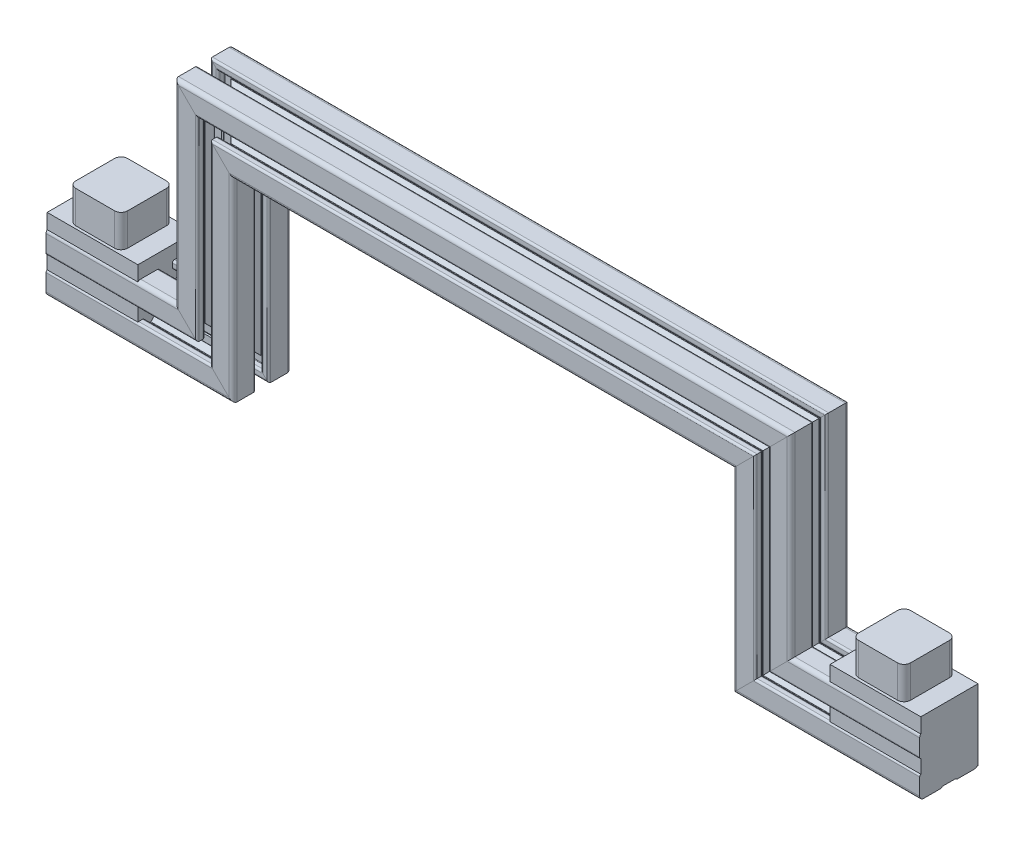
from build123d import *

# Parameters (mm, degrees)
SKETCH6_W            = 44.121320344
SKETCH6_H            = 54.791290411
BOSS_EXTRUDE3_DEPTH  = 70
SKETCH4_W            = 40
SKETCH4_H            = 40
RL_WHEEL_MOUNT_DEPTH = 25
FILLET1_R            = 5
FILLET1_OF_MIRROR1_R = 5


with BuildPart() as part:
    # Sweep1: sweep along a path in Sketch1
    with BuildLine(Plane.XY) as sweep1_path:
        Line((0, 0), (125, 0))
        Line((125, 0), (125, 150))
        Line((125, 150), (337, 150))
    # Sketch7 → Sweep1 (sweep)
    with BuildSketch(Plane(origin=(0, 0, 0), x_dir=(0, 0, -1), z_dir=(1, 0, 0))):
        with BuildLine():
            Line((4.905816029, 11.21531926), (4.005816103, 10.700171216))
            Line((4.005816103, 10.700171216), (3.105816176, 11.21531926))
            Line((3.105816176, 11.21531926), (-2.197508215, 11.21531926))
            ThreePointArc((-2.197508215, 11.21531926), (-2.342927919, 11.244245037), (-2.466208792, 11.326618683))
            Line((-2.466208792, 11.326618683), (-5.932884474, 14.793294365))
            ThreePointArc((-5.932884474, 14.793294365), (-6.01525812, 14.916575238), (-6.044183897, 15.061994942))
            Line((-6.044183897, 15.061994942), (-6.044183897, 19.35531926))
            ThreePointArc((-6.044183897, 19.35531926), (-5.932884474, 19.624019836), (-5.664183897, 19.73531926))
            Line((-5.664183897, 19.73531926), (-2.579183897, 19.73531926))
            ThreePointArc((-2.579183897, 19.73531926), (-1.50438159, 20.180516952), (-1.059183897, 21.25531926))
            Line((-1.059183897, 21.25531926), (-1.059183897, 24.21531926))
            ThreePointArc((-1.059183897, 24.21531926), (-1.50438159, 25.290121567), (-2.579183897, 25.73531926))
            Line((-2.579183897, 25.73531926), (-15.494183897, 25.73531926))
            ThreePointArc((-15.494183897, 25.73531926), (-17.615504241, 24.856639603), (-18.494183897, 22.73531926))
            Line((-18.494183897, 22.73531926), (-18.494183897, 9.82031926))
            ThreePointArc((-18.494183897, 9.82031926), (-18.048986205, 8.745516952), (-16.974183897, 8.30031926))
            Line((-16.974183897, 8.30031926), (-14.014183897, 8.30031926))
            ThreePointArc((-14.014183897, 8.30031926), (-12.93938159, 8.745516952), (-12.494183897, 9.82031926))
            Line((-12.494183897, 9.82031926), (-12.494183897, 12.90531926))
            ThreePointArc((-12.494183897, 12.90531926), (-12.382884474, 13.174019836), (-12.114183897, 13.28531926))
            Line((-12.114183897, 13.28531926), (-7.813788512, 13.28531926))
            ThreePointArc((-7.813788512, 13.28531926), (-7.668368808, 13.256393482), (-7.545087935, 13.174019836))
            Line((-7.545087935, 13.174019836), (-4.08548332, 9.714415222))
            ThreePointArc((-4.08548332, 9.714415222), (-4.003109675, 9.591134349), (-3.974183897, 9.445714645))
            Line((-3.974183897, 9.445714645), (-3.974183897, 4.135318895))
            Line((-3.974183897, 4.135318895), (-3.454570628, 3.23531926))
            Line((-3.454570628, 3.23531926), (-3.974183897, 2.335319624))
            Line((-3.974183897, 2.335319624), (-3.974183897, -2.968005058))
            ThreePointArc((-3.974183897, -2.968005058), (-4.003109675, -3.113424762), (-4.08548332, -3.236705635))
            Line((-4.08548332, -3.236705635), (-7.552159003, -6.703381317))
            ThreePointArc((-7.552159003, -6.703381317), (-7.675439876, -6.785754963), (-7.82085958, -6.81468074))
            Line((-7.82085958, -6.81468074), (-12.114183897, -6.81468074))
            ThreePointArc((-12.114183897, -6.81468074), (-12.382884474, -6.703381317), (-12.494183897, -6.43468074))
            Line((-12.494183897, -6.43468074), (-12.494183897, -3.34968074))
            ThreePointArc((-12.494183897, -3.34968074), (-12.93938159, -2.274878433), (-14.014183897, -1.82968074))
            Line((-14.014183897, -1.82968074), (-16.974183897, -1.82968074))
            ThreePointArc((-16.974183897, -1.82968074), (-18.048986205, -2.274878433), (-18.494183897, -3.34968074))
            Line((-18.494183897, -3.34968074), (-18.494183897, -16.26468074))
            ThreePointArc((-18.494183897, -16.26468074), (-17.615504241, -18.386001084), (-15.494183897, -19.26468074))
            Line((-15.494183897, -19.26468074), (-2.579183897, -19.26468074))
            ThreePointArc((-2.579183897, -19.26468074), (-1.50438159, -18.819483048), (-1.059183897, -17.74468074))
            Line((-1.059183897, -17.74468074), (-1.059183897, -14.78468074))
            ThreePointArc((-1.059183897, -14.78468074), (-1.50438159, -13.709878433), (-2.579183897, -13.26468074))
            Line((-2.579183897, -13.26468074), (-5.664183897, -13.26468074))
            ThreePointArc((-5.664183897, -13.26468074), (-5.932884474, -13.153381317), (-6.044183897, -12.88468074))
            Line((-6.044183897, -12.88468074), (-6.044183897, -8.584285355))
            ThreePointArc((-6.044183897, -8.584285355), (-6.01525812, -8.438865651), (-5.932884474, -8.315584778))
            Line((-5.932884474, -8.315584778), (-2.473279859, -4.855980164))
            ThreePointArc((-2.473279859, -4.855980164), (-2.349998987, -4.773606518), (-2.204579283, -4.74468074))
            Line((-2.204579283, -4.74468074), (3.105816176, -4.74468074))
            Line((3.105816176, -4.74468074), (4.005816103, -4.229532697))
            Line((4.005816103, -4.229532697), (4.905816029, -4.74468074))
            Line((4.905816029, -4.74468074), (10.20914042, -4.74468074))
            ThreePointArc((10.20914042, -4.74468074), (10.354560124, -4.773606518), (10.477840997, -4.855980164))
            Line((10.477840997, -4.855980164), (13.94451668, -8.322655846))
            ThreePointArc((13.94451668, -8.322655846), (14.026890325, -8.445936719), (14.055816103, -8.591356423))
            Line((14.055816103, -8.591356423), (14.055816103, -12.88468074))
            ThreePointArc((14.055816103, -12.88468074), (13.94451668, -13.153381317), (13.675816103, -13.26468074))
            Line((13.675816103, -13.26468074), (10.590816103, -13.26468074))
            ThreePointArc((10.590816103, -13.26468074), (9.516013795, -13.709878433), (9.070816103, -14.78468074))
            Line((9.070816103, -14.78468074), (9.070816103, -17.74468074))
            ThreePointArc((9.070816103, -17.74468074), (9.516013795, -18.819483048), (10.590816103, -19.26468074))
            Line((10.590816103, -19.26468074), (23.505816103, -19.26468074))
            ThreePointArc((23.505816103, -19.26468074), (25.627136446, -18.386001084), (26.505816103, -16.26468074))
            Line((26.505816103, -16.26468074), (26.505816103, -3.34968074))
            ThreePointArc((26.505816103, -3.34968074), (26.06061841, -2.274878433), (24.985816103, -1.82968074))
            Line((24.985816103, -1.82968074), (22.025816103, -1.82968074))
            ThreePointArc((22.025816103, -1.82968074), (20.951013795, -2.274878433), (20.505816103, -3.34968074))
            Line((20.505816103, -3.34968074), (20.505816103, -6.43468074))
            ThreePointArc((20.505816103, -6.43468074), (20.39451668, -6.703381317), (20.125816103, -6.81468074))
            Line((20.125816103, -6.81468074), (15.825420717, -6.81468074))
            ThreePointArc((15.825420717, -6.81468074), (15.680001013, -6.785754963), (15.556720141, -6.703381317))
            Line((15.556720141, -6.703381317), (12.097115526, -3.243776702))
            ThreePointArc((12.097115526, -3.243776702), (12.01474188, -3.12049583), (11.985816103, -2.975076126))
            Line((11.985816103, -2.975076126), (11.985816103, 2.335319624))
            Line((11.985816103, 2.335319624), (11.466202833, 3.23531926))
            Line((11.466202833, 3.23531926), (11.985816103, 4.135318895))
            Line((11.985816103, 4.135318895), (11.985816103, 9.438643577))
            ThreePointArc((11.985816103, 9.438643577), (12.01474188, 9.584063281), (12.097115526, 9.707344154))
            Line((12.097115526, 9.707344154), (15.563791208, 13.174019836))
            ThreePointArc((15.563791208, 13.174019836), (15.687072081, 13.256393482), (15.832491785, 13.28531926))
            Line((15.832491785, 13.28531926), (20.125816103, 13.28531926))
            ThreePointArc((20.125816103, 13.28531926), (20.39451668, 13.174019836), (20.505816103, 12.90531926))
            Line((20.505816103, 12.90531926), (20.505816103, 9.82031926))
            ThreePointArc((20.505816103, 9.82031926), (20.951013795, 8.745516952), (22.025816103, 8.30031926))
            Line((22.025816103, 8.30031926), (24.985816103, 8.30031926))
            ThreePointArc((24.985816103, 8.30031926), (26.06061841, 8.745516952), (26.505816103, 9.82031926))
            Line((26.505816103, 9.82031926), (26.505816103, 22.73531926))
            ThreePointArc((26.505816103, 22.73531926), (25.627136446, 24.856639603), (23.505816103, 25.73531926))
            Line((23.505816103, 25.73531926), (10.590816103, 25.73531926))
            ThreePointArc((10.590816103, 25.73531926), (9.516013795, 25.290121567), (9.070816103, 24.21531926))
            Line((9.070816103, 24.21531926), (9.070816103, 21.25531926))
            ThreePointArc((9.070816103, 21.25531926), (9.516013795, 20.180516952), (10.590816103, 19.73531926))
            Line((10.590816103, 19.73531926), (13.675816103, 19.73531926))
            ThreePointArc((13.675816103, 19.73531926), (13.94451668, 19.624019836), (14.055816103, 19.35531926))
            Line((14.055816103, 19.35531926), (14.055816103, 15.054923874))
            ThreePointArc((14.055816103, 15.054923874), (14.026890325, 14.90950417), (13.94451668, 14.786223298))
            Line((13.94451668, 14.786223298), (10.484912065, 11.326618683))
            ThreePointArc((10.484912065, 11.326618683), (10.361631192, 11.244245037), (10.216211488, 11.21531926))
            Line((10.216211488, 11.21531926), (4.905816029, 11.21531926))
        make_face()
        with BuildLine():
            Line((13.969837884, 21.274341041), (13.529837884, 21.274341041))
            ThreePointArc((13.529837884, 21.274341041), (12.469177713, 21.713680869), (12.029837884, 22.774341041))
            Line((12.029837884, 22.774341041), (12.029837884, 23.274341041))
            ThreePointArc((12.029837884, 23.274341041), (12.469177713, 24.335001213), (13.529837884, 24.774341041))
            Line((13.529837884, 24.774341041), (23.139837884, 24.774341041))
            ThreePointArc((23.139837884, 24.774341041), (24.752041345, 24.106544502), (25.419837884, 22.494341041))
            Line((25.419837884, 22.494341041), (25.419837884, 12.884341041))
            ThreePointArc((25.419837884, 12.884341041), (24.980498056, 11.823680869), (23.919837884, 11.384341041))
            Line((23.919837884, 11.384341041), (23.419837884, 11.384341041))
            ThreePointArc((23.419837884, 11.384341041), (22.359177713, 11.823680869), (21.919837884, 12.884341041))
            Line((21.919837884, 12.884341041), (21.919837884, 13.324341041))
            ThreePointArc((21.919837884, 13.324341041), (21.626944666, 14.031447822), (20.919837884, 14.324341041))
            Line((20.919837884, 14.324341041), (15.349837884, 14.324341041))
            ThreePointArc((15.349837884, 14.324341041), (15.081137307, 14.435640464), (14.969837884, 14.704341041))
            Line((14.969837884, 14.704341041), (14.969837884, 20.274341041))
            ThreePointArc((14.969837884, 20.274341041), (14.676944666, 20.981447822), (13.969837884, 21.274341041))
        make_face(mode=Mode.SUBTRACT)
        with BuildLine():
            Line((21.958859666, -6.68968074), (21.958859666, -6.24968074))
            ThreePointArc((21.958859666, -6.24968074), (22.398199494, -5.189020569), (23.458859666, -4.74968074))
            Line((23.458859666, -4.74968074), (23.958859666, -4.74968074))
            ThreePointArc((23.958859666, -4.74968074), (25.019519838, -5.189020569), (25.458859666, -6.24968074))
            Line((25.458859666, -6.24968074), (25.458859666, -15.85968074))
            ThreePointArc((25.458859666, -15.85968074), (24.791063127, -17.471884201), (23.178859666, -18.13968074))
            Line((23.178859666, -18.13968074), (13.568859666, -18.13968074))
            ThreePointArc((13.568859666, -18.13968074), (12.508199494, -17.700340912), (12.068859666, -16.63968074))
            Line((12.068859666, -16.63968074), (12.068859666, -16.13968074))
            ThreePointArc((12.068859666, -16.13968074), (12.508199494, -15.079020569), (13.568859666, -14.63968074))
            Line((13.568859666, -14.63968074), (14.008859666, -14.63968074))
            ThreePointArc((14.008859666, -14.63968074), (14.715966447, -14.346787522), (15.008859666, -13.63968074))
            Line((15.008859666, -13.63968074), (15.008859666, -8.06968074))
            ThreePointArc((15.008859666, -8.06968074), (15.120159089, -7.800980164), (15.388859666, -7.68968074))
            Line((15.388859666, -7.68968074), (20.958859666, -7.68968074))
            ThreePointArc((20.958859666, -7.68968074), (21.665966447, -7.396787522), (21.958859666, -6.68968074))
        make_face(mode=Mode.SUBTRACT)
        with BuildLine():
            Line((-6.005162116, -14.678702522), (-5.565162116, -14.678702522))
            ThreePointArc((-5.565162116, -14.678702522), (-4.504501944, -15.11804235), (-4.065162116, -16.178702522))
            Line((-4.065162116, -16.178702522), (-4.065162116, -16.678702522))
            ThreePointArc((-4.065162116, -16.678702522), (-4.504501944, -17.739362694), (-5.565162116, -18.178702522))
            Line((-5.565162116, -18.178702522), (-15.175162116, -18.178702522))
            ThreePointArc((-15.175162116, -18.178702522), (-16.787365577, -17.510905983), (-17.455162116, -15.898702522))
            Line((-17.455162116, -15.898702522), (-17.455162116, -6.288702522))
            ThreePointArc((-17.455162116, -6.288702522), (-17.015822287, -5.22804235), (-15.955162116, -4.788702522))
            Line((-15.955162116, -4.788702522), (-15.455162116, -4.788702522))
            ThreePointArc((-15.455162116, -4.788702522), (-14.394501944, -5.22804235), (-13.955162116, -6.288702522))
            Line((-13.955162116, -6.288702522), (-13.955162116, -6.728702522))
            ThreePointArc((-13.955162116, -6.728702522), (-13.662268897, -7.435809303), (-12.955162116, -7.728702522))
            Line((-12.955162116, -7.728702522), (-7.385162116, -7.728702522))
            ThreePointArc((-7.385162116, -7.728702522), (-7.116461539, -7.840001945), (-7.005162116, -8.108702522))
            Line((-7.005162116, -8.108702522), (-7.005162116, -13.678702522))
            ThreePointArc((-7.005162116, -13.678702522), (-6.712268897, -14.385809303), (-6.005162116, -14.678702522))
        make_face(mode=Mode.SUBTRACT)
        with BuildLine():
            Line((1.828915922, -2.488564034), (1.413170132, -2.316356489))
            ThreePointArc((1.413170132, -2.316356489), (0.823336155, -1.625307126), (1.036269925, -0.742067321))
            ThreePointArc((1.036269925, -0.742067321), (0.446703204, -0.237613869), (-0.057716637, 0.351981608))
            ThreePointArc((-0.057716637, 0.351981608), (-0.940937171, 0.139101897), (-1.631952253, 0.728927667))
            Line((-1.631952253, 0.728927667), (-1.804159798, 1.144673456))
            ThreePointArc((-1.804159798, 1.144673456), (-1.732589712, 2.050394753), (-0.957477943, 2.524372695))
            ThreePointArc((-0.957477943, 2.524372695), (-1.017662114, 3.297961778), (-0.957433843, 4.071547428))
            ThreePointArc((-0.957433843, 4.071547428), (-1.73249376, 4.54554997), (-1.804045409, 5.451241222))
            Line((-1.804045409, 5.451241222), (-1.631837865, 5.866987012))
            ThreePointArc((-1.631837865, 5.866987012), (-0.940788501, 6.456820989), (-0.057548696, 6.243887219))
            ThreePointArc((-0.057548696, 6.243887219), (0.446904755, 6.83345394), (1.036500233, 7.33787378))
            ThreePointArc((1.036500233, 7.33787378), (0.823620522, 8.221094315), (1.413446291, 8.912109397))
            Line((1.413446291, 8.912109397), (1.829192081, 9.084316942))
            ThreePointArc((1.829192081, 9.084316942), (2.734913377, 9.012746856), (3.20889132, 8.237635087))
            ThreePointArc((3.20889132, 8.237635087), (3.982480402, 8.297819258), (4.756066053, 8.237590987))
            ThreePointArc((4.756066053, 8.237590987), (5.230068594, 9.012650904), (6.135759847, 9.084202553))
            Line((6.135759847, 9.084202553), (6.551505636, 8.911995008))
            ThreePointArc((6.551505636, 8.911995008), (7.141339614, 8.220945645), (6.928405843, 7.33770584))
            ThreePointArc((6.928405843, 7.33770584), (7.517972564, 6.833252389), (8.022392405, 6.243656911))
            ThreePointArc((8.022392405, 6.243656911), (8.905612939, 6.456536622), (9.596628022, 5.866710852))
            Line((9.596628022, 5.866710852), (9.768835567, 5.450965063))
            ThreePointArc((9.768835567, 5.450965063), (9.697265481, 4.545243766), (8.922153712, 4.071265824))
            ThreePointArc((8.922153712, 4.071265824), (8.982337882, 3.297676741), (8.922109612, 2.524091091))
            ThreePointArc((8.922109612, 2.524091091), (9.697169528, 2.05008855), (9.768721178, 1.144397297))
            Line((9.768721178, 1.144397297), (9.596513633, 0.728651507))
            ThreePointArc((9.596513633, 0.728651507), (8.90546427, 0.13881753), (8.022224464, 0.351751301))
            ThreePointArc((8.022224464, 0.351751301), (7.517771013, -0.23781542), (6.928175536, -0.742235261))
            ThreePointArc((6.928175536, -0.742235261), (7.141055247, -1.625455795), (6.551229477, -2.316470878))
            Line((6.551229477, -2.316470878), (6.135483688, -2.488678423))
            ThreePointArc((6.135483688, -2.488678423), (5.229762391, -2.417108337), (4.755784449, -1.641996568))
            ThreePointArc((4.755784449, -1.641996568), (3.982195366, -1.702180738), (3.208609716, -1.641952468))
            ThreePointArc((3.208609716, -1.641952468), (2.734607174, -2.417012384), (1.828915922, -2.488564034))
        make_face(mode=Mode.SUBTRACT)
        with BuildLine():
            Line((-13.994183897, 13.28531926), (-13.994183897, 12.84531926))
            ThreePointArc((-13.994183897, 12.84531926), (-14.433523726, 11.784659088), (-15.494183897, 11.34531926))
            Line((-15.494183897, 11.34531926), (-15.994183897, 11.34531926))
            ThreePointArc((-15.994183897, 11.34531926), (-17.054844069, 11.784659088), (-17.494183897, 12.84531926))
            Line((-17.494183897, 12.84531926), (-17.494183897, 22.45531926))
            ThreePointArc((-17.494183897, 22.45531926), (-16.826387358, 24.067522721), (-15.214183897, 24.73531926))
            Line((-15.214183897, 24.73531926), (-5.604183897, 24.73531926))
            ThreePointArc((-5.604183897, 24.73531926), (-4.543523726, 24.295979431), (-4.104183897, 23.23531926))
            Line((-4.104183897, 23.23531926), (-4.104183897, 22.73531926))
            ThreePointArc((-4.104183897, 22.73531926), (-4.543523726, 21.674659088), (-5.604183897, 21.23531926))
            Line((-5.604183897, 21.23531926), (-6.044183897, 21.23531926))
            ThreePointArc((-6.044183897, 21.23531926), (-6.751290679, 20.942426041), (-7.044183897, 20.23531926))
            Line((-7.044183897, 20.23531926), (-7.044183897, 14.66531926))
            ThreePointArc((-7.044183897, 14.66531926), (-7.15548332, 14.396618683), (-7.424183897, 14.28531926))
            Line((-7.424183897, 14.28531926), (-12.994183897, 14.28531926))
            ThreePointArc((-12.994183897, 14.28531926), (-13.701290679, 13.992426041), (-13.994183897, 13.28531926))
        make_face(mode=Mode.SUBTRACT)
    sweep1 = sweep(path=sweep1_path.line, transition=Transition.RIGHT)

    # Sketch6 → Boss-Extrude3 (add)
    with BuildSketch(Plane.ZY):
        with Locations((-4.445155931, 9.009644122)):
            Rectangle(SKETCH6_W, SKETCH6_H)
    boss_extrude3 = extrude(amount=-BOSS_EXTRUDE3_DEPTH)

    # Sketch4 → RL Wheel Mount (add)
    with BuildSketch(Plane(origin=(0, 36.405289327, 0), x_dir=(1, 0, 0), z_dir=(0, 1, 0))):
        with Locations((35, 4.445155931)):
            Rectangle(SKETCH4_W, SKETCH4_H)
    rl_wheel_mount = extrude(amount=RL_WHEEL_MOUNT_DEPTH)

    # Fillet1
    fillet1_edges = [part.edges().sort_by_distance(p)[0] for p in [
        (15, 48.905289327, -24.445155931),
        (55, 48.905289327, -24.445155931),
        (55, 48.905289327, 15.554844069),
        (15, 48.905289327, 15.554844069),
    ]]
    fillet(fillet1_edges, radius=FILLET1_R)

    # Mirror1: Sweep1, Boss-Extrude3, RL Wheel Mount across plane
    add(sweep1.mirror(Plane(origin=(337, 0, 0), x_dir=(0, 0, 1), z_dir=(1, 0, 0))))
    add(boss_extrude3.mirror(Plane(origin=(337, 0, 0), x_dir=(0, 0, 1), z_dir=(1, 0, 0))))
    add(rl_wheel_mount.mirror(Plane(origin=(337, 0, 0), x_dir=(0, 0, 1), z_dir=(1, 0, 0))))

    # Fillet1 of Mirror1
    fillet1_of_mirror1_edges = [part.edges().sort_by_distance(p)[0] for p in [
        (659, 48.905289327, -24.445155931),
        (619, 48.905289327, -24.445155931),
        (619, 48.905289327, 15.554844069),
        (659, 48.905289327, 15.554844069),
    ]]
    fillet(fillet1_of_mirror1_edges, radius=FILLET1_OF_MIRROR1_R)


solid = part.part
